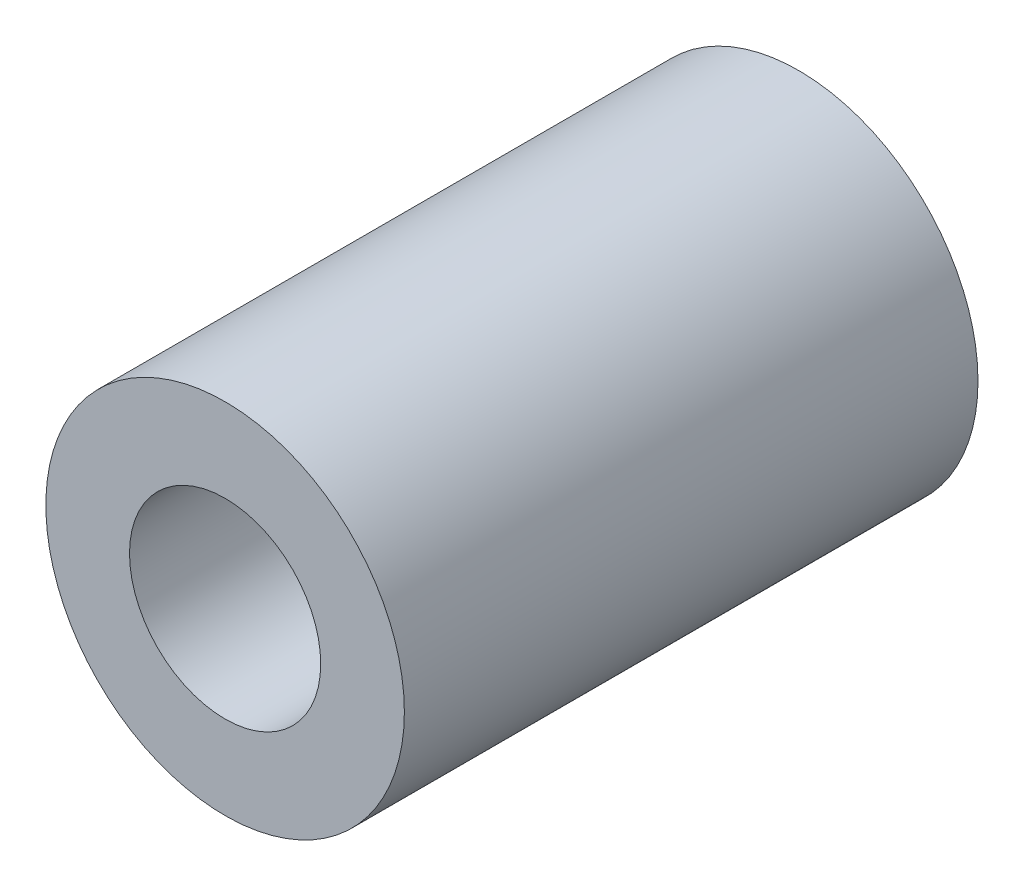
from build123d import *

# Parameters (mm, degrees)
BOSS_EXTRU_1_DEPTH      = 12
BOSS_EXTRU_1_DEPTH_BACK = 12
ESQUISSE2_R             = 7.5
ESQUISSE2_R_2           = 4


with BuildPart() as part:
    # Esquisse2 → Boss.-Extru.1 (new, two sides: drawn at the far end of the back side and taken through both)
    with BuildSketch(Plane.XY.offset(-BOSS_EXTRU_1_DEPTH_BACK)):
        Circle(ESQUISSE2_R)
        Circle(ESQUISSE2_R_2, mode=Mode.SUBTRACT)
    extrude(amount=BOSS_EXTRU_1_DEPTH + BOSS_EXTRU_1_DEPTH_BACK)


solid = part.part
